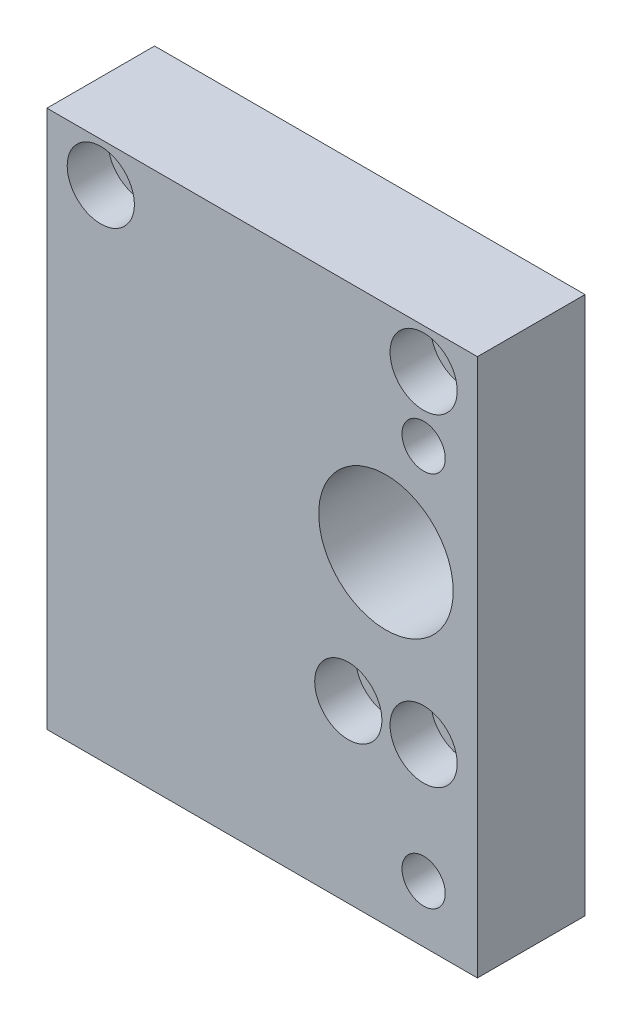
from build123d import *

# Parameters (mm, degrees)
SKETCH1_W                                       = 50.8
SKETCH1_H                                       = 50.8
SKETCH1_R                                       = 2.5527
SKETCH1_R_2                                     = 7.9375
BOSS_EXTRUDE1_DEPTH                             = 12.7
SKETCH2_W                                       = 50.8
SKETCH2_H                                       = 12.7
BOSS_EXTRUDE2_DEPTH                             = 12.7
CBORE_FOR_10_SOCKET_HEAD_CAP_SCREW1_D           = 5.1054
CBORE_FOR_10_SOCKET_HEAD_CAP_SCREW1_CBORE_D     = 7.9248
CBORE_FOR_10_SOCKET_HEAD_CAP_SCREW1_CBORE_DEPTH = 4.826
SKETCH6_R                                       = 3.9624
CUT_EXTRUDE1_DEPTH                              = 4.826


with BuildPart() as part:
    # Sketch1 → Boss-Extrude1 (new body)
    with BuildSketch(Plane.XY):
        Rectangle(SKETCH1_W, SKETCH1_H)
        with Locations((-19.05, 20.701)):
            Circle(SKETCH1_R, mode=Mode.SUBTRACT)
        with Locations((19.05, 20.701)):
            Circle(SKETCH1_R, mode=Mode.SUBTRACT)
        with Locations((19.05, -17.399)):
            Circle(SKETCH1_R, mode=Mode.SUBTRACT)
        with Locations((10.16, -17.399)):
            Circle(SKETCH1_R, mode=Mode.SUBTRACT)
        with Locations((14.605, 0)):
            Circle(SKETCH1_R_2, mode=Mode.SUBTRACT)
    extrude(amount=BOSS_EXTRUDE1_DEPTH)

    # Sketch2 → Boss-Extrude2 (add)
    with BuildSketch(Plane.XZ.offset(25.4)):
        with Locations((0, 6.35)):
            Rectangle(SKETCH2_W, SKETCH2_H)
    extrude(amount=BOSS_EXTRUDE2_DEPTH)

    # CBORE for #10 Socket Head Cap Screw1 (through all)
    with Locations(Plane(origin=(-24.721209515, -12.864288698, 0), x_dir=(1, 0, 0), z_dir=(0, 0, -1))):
        with Locations((43.771209515, 18.504711302), (43.771209515, -25.945288698)):
            CounterBoreHole(CBORE_FOR_10_SOCKET_HEAD_CAP_SCREW1_D / 2, CBORE_FOR_10_SOCKET_HEAD_CAP_SCREW1_CBORE_D / 2, CBORE_FOR_10_SOCKET_HEAD_CAP_SCREW1_CBORE_DEPTH)

    # Sketch6 → Cut-Extrude1 (cut)
    with BuildSketch(Plane(origin=(0, 0, 12.7), x_dir=(-1, 0, 0), z_dir=(0, 0, -1))):
        with Locations((-19.05, 20.701)):
            Circle(SKETCH6_R)
        with Locations((-19.05, -17.399)):
            Circle(SKETCH6_R)
        with Locations((-10.16, -17.399)):
            Circle(SKETCH6_R)
        with Locations((19.05, 20.701)):
            Circle(SKETCH6_R)
    extrude(amount=CUT_EXTRUDE1_DEPTH, mode=Mode.SUBTRACT)


solid = part.part
